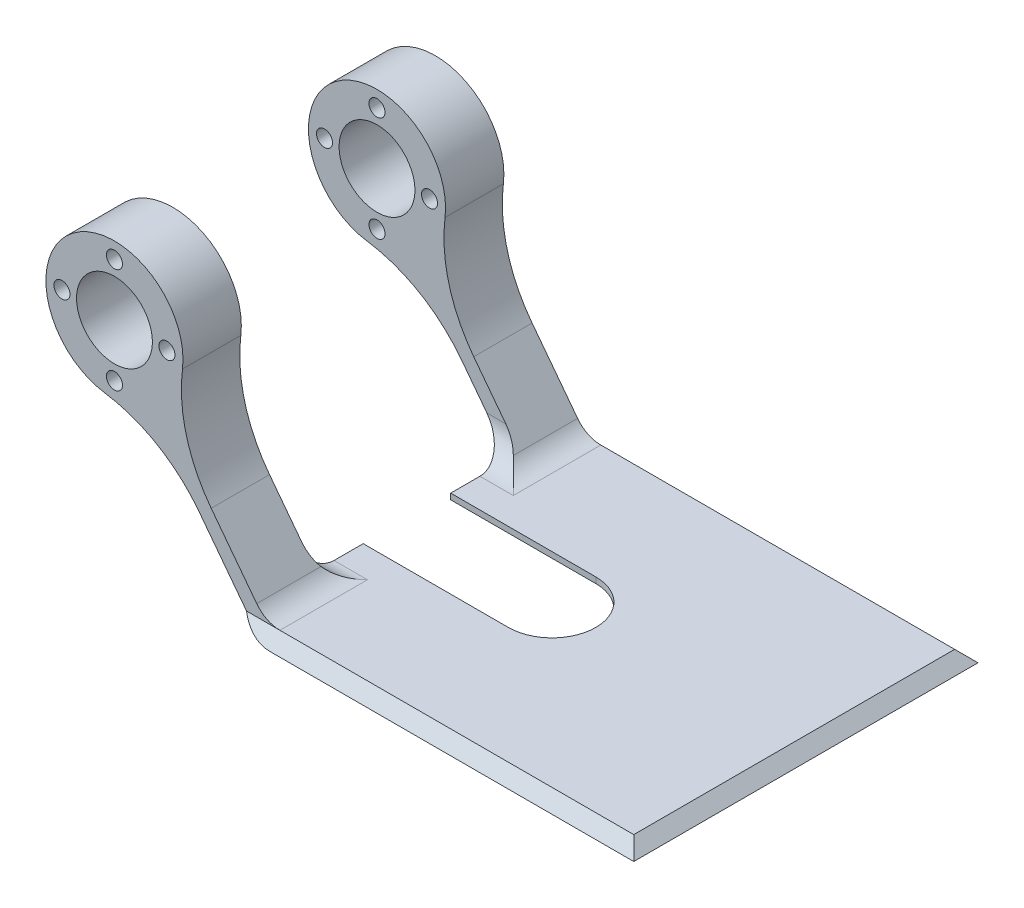
from build123d import *

# Parameters (mm, degrees)
SKETCH1_W           = 142.75
SKETCH1_H           = 130
BOSS_EXTRUDE1_DEPTH = 4
CHAMFER4_SIZE       = 10
CHAMFER5_SIZE       = 10
SKETCH11_R          = 23.5
SKETCH11_R_2        = 2.75
SKETCH11_R_3        = 13
BOSS_EXTRUDE3_DEPTH = 20
CUT_EXTRUDE3_REACH  = 177.695
FILLET5_R           = 20
FILLET8_R           = 10
FILLET9_R           = 50
BOSS_EXTRUDE5_DEPTH = 2


with BuildPart() as part:
    # Sketch1 → Boss-Extrude1 (new body)
    with BuildSketch(Plane(origin=(0, 0, 0), x_dir=(1, 0, 0), z_dir=(0, 1, 0))):
        with Locations((-0.404975067, 0.207290513)):
            Rectangle(SKETCH1_W, SKETCH1_H)
    extrude(amount=BOSS_EXTRUDE1_DEPTH)

    # Chamfer4
    # the kernel refuses this chamfer: 10 mm, written as the material it takes off along each edge
    with BuildSketch(Plane(origin=(-97.496804946, 4, -65.207290513), x_dir=(0, -1, 0), z_dir=(1, 0, 0)), Plane(origin=(96.686854813, 4, 64.792709487), x_dir=(0, -1, 0), z_dir=(-1, 0, 0))) as chamfer4_piece_1:
        Polygon((CHAMFER4_SIZE, 0), (0, -CHAMFER4_SIZE), (0, 0), align=None)
    extrude(amount=194.183659759, mode=Mode.SUBTRACT)

    # Chamfer5
    # the kernel refuses this chamfer: 10 mm, written as the material it takes off along each edge
    with BuildSketch(Plane(origin=(70.970024933, 4, -80.924120393), x_dir=(-1, 0, 0), z_dir=(0, 0, 1))) as chamfer5_piece_1:
        Polygon((CHAMFER5_SIZE, 0), (0, CHAMFER5_SIZE), (0, 0), align=None)
    extrude(amount=161.433659759, mode=Mode.SUBTRACT)

    # Sketch11 → Boss-Extrude3 (add)
    # profile 1 of 2: a face of its own
    with BuildSketch(Plane(origin=(0, 0, 54.792709487), x_dir=(-1, 0, 0), z_dir=(0, 0, -1))):
        with Locations((117.047641156, 67.733126253)):
            Circle(SKETCH11_R)
        with Locations((99.047641156, 67.733126253)):
            Circle(SKETCH11_R_2, mode=Mode.SUBTRACT)
        with Locations((117.047641156, 85.733126253)):
            Circle(SKETCH11_R_2, mode=Mode.SUBTRACT)
        with Locations((135.047641156, 67.733126253)):
            Circle(SKETCH11_R_2, mode=Mode.SUBTRACT)
        with Locations((117.047641156, 49.733126253)):
            Circle(SKETCH11_R_2, mode=Mode.SUBTRACT)
        with Locations((117.047641156, 67.733126253)):
            Circle(SKETCH11_R_3, mode=Mode.SUBTRACT)
    # profile 2 of 2: a face of its own
    with BuildSketch(Plane(origin=(0, 0, 54.792709487), x_dir=(-1, 0, 0), z_dir=(0, 0, -1))):
        Polygon((65.279975067, 4), (71.779975067, 4), (110.625146065, 55.02727289), (106.509975067, 58.16), align=None)
    boss_extrude3 = extrude(amount=BOSS_EXTRUDE3_DEPTH)

    # Sketch12 → Cut-Extrude3 (cut, up to next)
    with BuildSketch(Plane(origin=(0, 4, 0), x_dir=(1, 0, 0), z_dir=(0, 1, 0)), mode=Mode.PRIVATE) as cut_extrude3_sk1:
        with BuildLine():
            Line((-62.033374936, -22.292709487), (12.966625064, -22.292709487))
            ThreePointArc((12.966625064, -22.292709487), (20.037692876, -19.363777299), (22.966625064, -12.292709487))
            Line((22.966625064, -12.292709487), (22.966625064, 22.707290513))
            Line((22.966625064, 22.707290513), (-62.033374936, 22.707290513))
            ThreePointArc((-62.033374936, 22.707290513), (-67.848507835, 20.84265955), (-71.495025362, 15.944136388))
            ThreePointArc((-71.495025362, 15.944136388), (-71.630244869, 15.572907696), (-71.779975067, 15.207290513))
            Line((-71.779975067, 15.207290513), (-71.779975067, -14.792709487))
            ThreePointArc((-71.779975067, -14.792709487), (-71.630247327, -15.158320315), (-71.495029773, -15.529542467))
            ThreePointArc((-71.495029773, -15.529542467), (-67.848513378, -20.428074562), (-62.033374936, -22.292709487))
        make_face()
    cut_extrude3_tool1 = extrude(cut_extrude3_sk1.sketch, amount=-CUT_EXTRUDE3_REACH, mode=Mode.PRIVATE) & part.part
    add(cut_extrude3_tool1.solids().sort_by_distance((-24.222891, 4, -0.310755))[0], mode=Mode.SUBTRACT)

    # Fillet5
    # the kernel refuses this fillet: 20 mm, written as the material it takes off along each edge
    with BuildSketch(Plane(origin=(-71.779975067, 0, 14.792709487), x_dir=(1, 0, 0), z_dir=(0, 0, -1))) as fillet5_piece_1:
        with BuildLine():
            CenterArc((12, -20), FILLET5_R, 90, 36.869897646)
            Line((0, -4), (-0.24, -3.68))
            ThreePointArc((-0.24, -3.68), (-0.4, -2), (-0.4, 0))
            Line((-0.4, 0), (0, 0.4))
            Line((0, 0.4), (12, 0.4))
            Line((12, 0.4), (12, 0))
        make_face()
    extrude(amount=104, mode=Mode.SUBTRACT)
    with BuildSketch(Plane(origin=(-71.779975067, 0, 88.792709487), x_dir=(0, 1, 0), z_dir=(0, 0, -1))) as fillet5_piece_2:
        with BuildLine():
            CenterArc((20, 12), FILLET5_R, 180, 36.869897646)
            Line((0, 12), (-0.4, 12))
            Line((-0.4, 12), (-0.4, 0))
            Line((-0.4, 0), (0, -0.4))
            ThreePointArc((0, -0.4), (2, -0.4), (3.68, -0.24))
            Line((3.68, -0.24), (4, 0))
        make_face()
    extrude(amount=104, mode=Mode.SUBTRACT)

    # Mirror3: Boss-Extrude3 across plane
    add(boss_extrude3.mirror(Plane.XY.offset(-0.207290513)))

    # Fillet8
    # the kernel refuses this fillet: 10 mm, written as the material it adds along each edge
    with BuildSketch(Plane(origin=(-40.279975067, 4, -35.207290513), x_dir=(0, 0, 1), z_dir=(-1, 0, 0))) as fillet8_piece_1_section:
        with BuildLine():
            CenterArc((FILLET8_R, FILLET8_R), FILLET8_R, 180, 90)
            Line((0, FILLET8_R), (0, 0))
            Line((0, 0), (FILLET8_R, 0))
        make_face()
    fillet8_piece_1 = extrude(amount=56.5, mode=Mode.PRIVATE)
    fillet8_piece_1 = split(fillet8_piece_1, bisect_by=Plane(origin=(-56.107555829, -8.048950422, -35.207290513), z_dir=(-0.7956778434191335, -0.6057200421744992, 0)), keep=Keep.TOP, mode=Mode.PRIVATE)
    fillet8_piece_1 = split(fillet8_piece_1, bisect_by=Plane(origin=(-60.222726828, -11.181677532, -35.207290513), z_dir=(0.7956778434191335, 0.605720042174499, 0)), keep=Keep.TOP, mode=Mode.PRIVATE)
    add(fillet8_piece_1)
    with BuildSketch(Plane(origin=(-65.279975067, 4, -55.207290513), x_dir=(1, 0, 0), z_dir=(0, 0, 1))) as fillet8_piece_2:
        with BuildLine():
            CenterArc((FILLET8_R * 0.495527129587, FILLET8_R), FILLET8_R, 217.280673383, 52.719326617)
            Line((-FILLET8_R * 0.300150713832, FILLET8_R * 0.394279957825), (0, 0))
            Line((0, 0), (FILLET8_R * 0.495527129587, 0))
        make_face()
    extrude(amount=20)
    with BuildSketch(Plane(origin=(-65.279975067, 4, 54.792709487), x_dir=(1, 0, 0), z_dir=(0, 0, -1))) as fillet8_piece_3:
        with BuildLine():
            CenterArc((FILLET8_R * 0.495527129587, -FILLET8_R), FILLET8_R, 90, 52.719326617)
            Line((-FILLET8_R * 0.300150713832, -FILLET8_R * 0.394279957825), (0, 0))
            Line((0, 0), (FILLET8_R * 0.495527129587, 0))
        make_face()
    extrude(amount=20)
    with BuildSketch(Plane(origin=(-40.279975067, 4, 34.792709487), x_dir=(0, 0, -1), z_dir=(-1, 0, 0))) as fillet8_piece_4_section:
        with BuildLine():
            CenterArc((FILLET8_R, -FILLET8_R), FILLET8_R, 90, 90)
            Line((0, -FILLET8_R), (0, 0))
            Line((0, 0), (FILLET8_R, 0))
        make_face()
    fillet8_piece_4 = extrude(amount=56.5, mode=Mode.PRIVATE)
    fillet8_piece_4 = split(fillet8_piece_4, bisect_by=Plane(origin=(-56.107555829, -8.048950422, 34.792709487), z_dir=(-0.7956778434191335, -0.6057200421744992, 0)), keep=Keep.TOP, mode=Mode.PRIVATE)
    fillet8_piece_4 = split(fillet8_piece_4, bisect_by=Plane(origin=(-60.222726828, -11.181677532, 34.792709487), z_dir=(0.7956778434191335, 0.605720042174499, 0)), keep=Keep.TOP, mode=Mode.PRIVATE)
    add(fillet8_piece_4)
    with BuildSketch(Plane(origin=(-65.279975067, 4, -55.207290513), x_dir=(1, 0, 0), z_dir=(0, 0, 1))) as fillet8_piece_5a_section:
        with BuildLine():
            CenterArc((FILLET8_R * 0.495527129587, FILLET8_R), FILLET8_R, 217.280673383, 52.719326617)
            Line((-FILLET8_R * 0.300150713832, FILLET8_R * 0.394279957825), (0, 0))
            Line((0, 0), (FILLET8_R * 0.495527129587, 0))
        make_face()
    fillet8_piece_5a = extrude(amount=32.38817824, mode=Mode.PRIVATE)
    fillet8_piece_5a = split(fillet8_piece_5a, bisect_by=Plane(origin=(-65.279975067, 4, -35.207290513), z_dir=(0, 0, 1)), keep=Keep.TOP, mode=Mode.PRIVATE)
    with BuildSketch(Plane(origin=(-40.279975067, 4, -35.207290513), x_dir=(0, 0, 1), z_dir=(-1, 0, 0))) as fillet8_piece_5b_section:
        with BuildLine():
            CenterArc((FILLET8_R, FILLET8_R), FILLET8_R, 180, 90)
            Line((0, FILLET8_R), (0, 0))
            Line((0, 0), (FILLET8_R, 0))
        make_face()
    fillet8_piece_5b = extrude(amount=56.5, mode=Mode.PRIVATE)
    fillet8_piece_5b = split(fillet8_piece_5b, bisect_by=Plane(origin=(-56.107555829, -8.048950422, -35.207290513), z_dir=(0.7956778434191335, 0.6057200421744992, 0)), keep=Keep.TOP, mode=Mode.PRIVATE)
    fillet8_piece_5b = fillet8_piece_5b & Plane(origin=(-59.779975067, 20, -35.207290513), x_dir=(1, 0, 0), z_dir=(0, 0, 1)) * Cylinder(20, 154, mode=Mode.PRIVATE)
    fillet8_piece_5 = fillet8_piece_5a & fillet8_piece_5b
    add(fillet8_piece_5)
    with BuildSketch(Plane(origin=(-40.279975067, 4, 34.792709487), x_dir=(0, 0, -1), z_dir=(-1, 0, 0))) as fillet8_piece_6a_section:
        with BuildLine():
            CenterArc((FILLET8_R, -FILLET8_R), FILLET8_R, 90, 90)
            Line((0, -FILLET8_R), (0, 0))
            Line((0, 0), (FILLET8_R, 0))
        make_face()
    fillet8_piece_6a = extrude(amount=56.5, mode=Mode.PRIVATE)
    fillet8_piece_6a = fillet8_piece_6a & Plane(origin=(-59.779975067, 20, 34.792709487), x_dir=(0, 1, 0), z_dir=(0, 0, 1)) * Cylinder(20, 154, mode=Mode.PRIVATE)
    fillet8_piece_6a = split(fillet8_piece_6a, bisect_by=Plane(origin=(-56.107555829, -8.048950422, 34.792709487), z_dir=(0.7956778434191335, 0.6057200421744992, 0)), keep=Keep.TOP, mode=Mode.PRIVATE)
    with BuildSketch(Plane(origin=(-65.279975067, 4, 54.792709487), x_dir=(1, 0, 0), z_dir=(0, 0, -1))) as fillet8_piece_6b_section:
        with BuildLine():
            CenterArc((FILLET8_R * 0.495527129587, -FILLET8_R), FILLET8_R, 90, 52.719326617)
            Line((-FILLET8_R * 0.300150713832, -FILLET8_R * 0.394279957825), (0, 0))
            Line((0, 0), (FILLET8_R * 0.495527129587, 0))
        make_face()
    fillet8_piece_6b = extrude(amount=32.38817824, mode=Mode.PRIVATE)
    fillet8_piece_6b = split(fillet8_piece_6b, bisect_by=Plane(origin=(-65.279975067, 4, 34.792709487), z_dir=(0, 0, -1)), keep=Keep.TOP, mode=Mode.PRIVATE)
    fillet8_piece_6 = fillet8_piece_6a & fillet8_piece_6b
    add(fillet8_piece_6)

    # Fillet9
    fillet9_edges = [part.edges().sort_by_distance(p)[0] for p in [
        (-104.957249904, 47.581887101, -45.207290513),
        (-100.842078905, 50.714614211, -45.207290513),
        (-104.957249904, 47.581887101, 44.792709487),
        (-100.842078905, 50.714614211, 44.792709487),
    ]]
    fillet(fillet9_edges, radius=FILLET9_R)

    # Sketch14 → Boss-Extrude5 (add)
    with BuildSketch(Plane(origin=(0, 4, 0), x_dir=(1, 0, 0), z_dir=(0, 1, 0))):
        with BuildLine():
            Line((-71.779975067, 15.207290513), (-22.033374936, 15.207290513))
            ThreePointArc((-22.033374936, 15.207290513), (-7.033374936, 0.207290513), (-22.033374936, -14.792709487))
            Line((-22.033374936, -14.792709487), (-71.779975067, -14.792709487))
            ThreePointArc((-71.779975067, -14.792709487), (-71.630247327, -15.158320315), (-71.495029773, -15.529542467))
            ThreePointArc((-71.495029773, -15.529542467), (-67.848513378, -20.428074562), (-62.033374936, -22.292709487))
            Line((-62.033374936, -22.292709487), (12.966625064, -22.292709487))
            ThreePointArc((12.966625064, -22.292709487), (20.037692876, -19.363777299), (22.966625064, -12.292709487))
            Line((22.966625064, -12.292709487), (22.966625064, 22.707290513))
            Line((22.966625064, 22.707290513), (-62.033374936, 22.707290513))
            ThreePointArc((-62.033374936, 22.707290513), (-67.848507835, 20.84265955), (-71.495025362, 15.944136388))
            ThreePointArc((-71.495025362, 15.944136388), (-71.630244869, 15.572907696), (-71.779975067, 15.207290513))
        make_face()
    extrude(amount=-BOSS_EXTRUDE5_DEPTH)


solid = part.part
